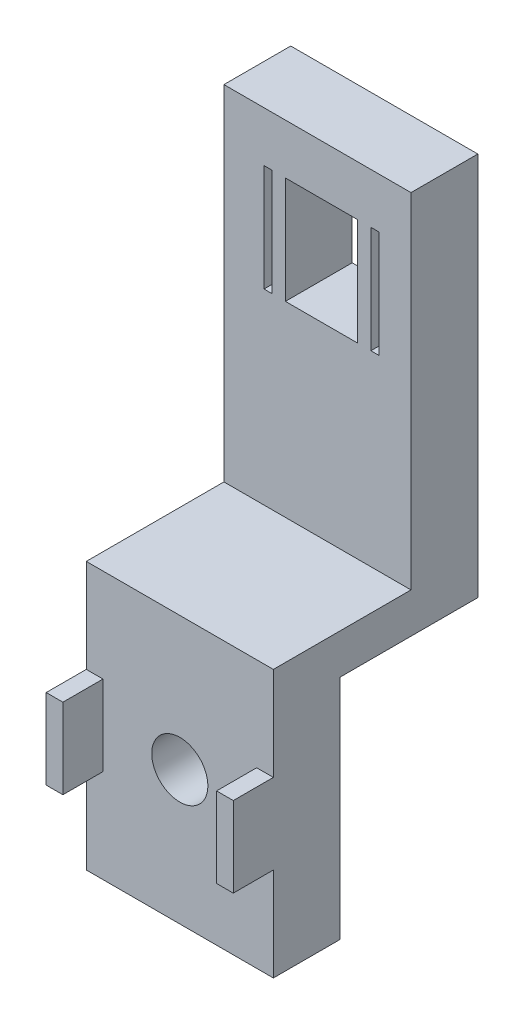
from build123d import *

# Parameters (mm, degrees)
SKETCH1_W           = 14
SKETCH1_H           = 45.75
SKETCH1_W_2         = 5.4
SKETCH1_H_2         = 8
SKETCH1_W_3         = 0.6
SKETCH1_R           = 2.1
BOSS_EXTRUDE3_DEPTH = 15.3
SKETCH2_W           = 10.3
SKETCH2_H           = 17
SKETCH2_H_2         = 25.75
CUT_EXTRUDE1_DEPTH  = 21
SKETCH3_W           = 1.25
SKETCH3_H           = 6
BOSS_EXTRUDE4_DEPTH = 3


with BuildPart() as part:
    # Sketch1 → Boss-Extrude3 (new body)
    with BuildSketch(Plane.XY):
        with Locations((7, 22.875)):
            Rectangle(SKETCH1_W, SKETCH1_H)
        with Locations((7.3, 38)):
            Rectangle(SKETCH1_W_2, SKETCH1_H_2, mode=Mode.SUBTRACT)
        with Locations((3.3, 38)):
            Rectangle(SKETCH1_W_3, SKETCH1_H_2, mode=Mode.SUBTRACT)
        with Locations((7, 10)):
            Circle(SKETCH1_R, mode=Mode.SUBTRACT)
        with Locations((11.3, 38)):
            Rectangle(SKETCH1_W_3, SKETCH1_H_2, mode=Mode.SUBTRACT)
    extrude(amount=BOSS_EXTRUDE3_DEPTH)

    # Sketch2 → Cut-Extrude1 (cut)
    with BuildSketch(Plane.ZY):
        with Locations((5.15, 8.5)):
            Rectangle(SKETCH2_W, SKETCH2_H)
        with Locations((10.15, 32.875)):
            Rectangle(SKETCH2_W, SKETCH2_H_2)
    extrude(amount=-CUT_EXTRUDE1_DEPTH, mode=Mode.SUBTRACT)

    # Sketch3 → Boss-Extrude4 (add)
    with BuildSketch(Plane.XY.offset(15.3)):
        with Locations((0.625, 10)):
            Rectangle(SKETCH3_W, SKETCH3_H)
        with Locations((13.375, 10)):
            Rectangle(SKETCH3_W, SKETCH3_H)
    extrude(amount=BOSS_EXTRUDE4_DEPTH)


solid = part.part
